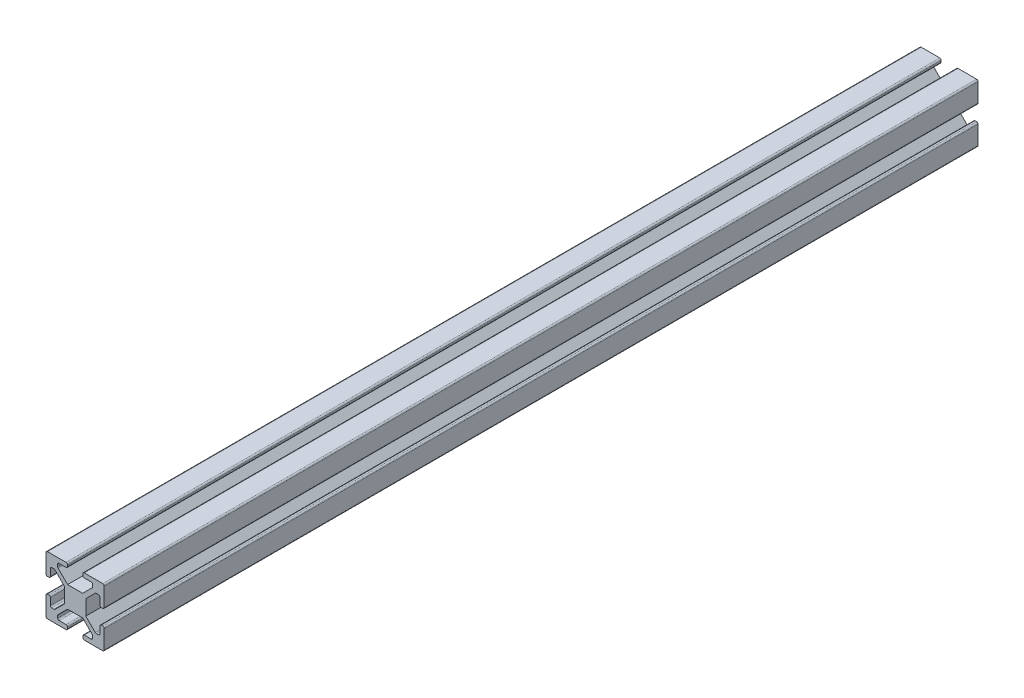
from build123d import *

# Parameters (mm, degrees)
BOSS_EXTRUDE1_DEPTH = 300
FILLET1_R           = 0.5


with BuildPart() as part:
    # Sketch1 → Boss-Extrude1 (new body)
    with BuildSketch(Plane.XY):
        Polygon((-10, 2.63), (-10, 10), (-2.63, 10), (-2.63, 8.5), (-5.995, 8.5), (-5.995, 7.055660172), (-2.594339828, 3.655), (2.594339828, 3.655), (5.995, 7.055660172), (5.995, 8.5), (2.63, 8.5), (2.63, 10), (10, 10), (10, 2.63), (8.5, 2.63), (8.5, 5.995), (7.055660172, 5.995), (3.655, 2.594339828), (3.655, -2.594339828), (7.055660172, -5.995), (8.5, -5.995), (8.5, -2.63), (10, -2.63), (10, -10), (2.63, -10), (2.63, -8.5), (5.995, -8.5), (5.995, -7.055660172), (2.594339828, -3.655), (-2.594339828, -3.655), (-5.995, -7.055660172), (-5.995, -8.5), (-2.63, -8.5), (-2.63, -10), (-10, -10), (-10, -2.63), (-8.5, -2.63), (-8.5, -5.995), (-7.055660172, -5.995), (-3.655, -2.594339828), (-3.655, 2.594339828), (-7.055660172, 5.995), (-8.5, 5.995), (-8.5, 2.63), align=None)
    extrude(amount=-BOSS_EXTRUDE1_DEPTH)

    # Fillet1
    fillet1_edges = [part.edges().sort_by_distance(p)[0] for p in [
        (10, 10, -150),
        (7.055660172, 5.995, -150),
        (8.5, 2.63, -150),
        (10, 2.63, -150),
        (8.5, 5.995, -150),
        (2.63, 10, -150),
        (2.63, 8.5, -150),
        (5.995, 8.5, -150),
        (5.995, 7.055660172, -150),
        (10, -10, -150),
        (10, -2.63, -150),
        (8.5, -2.63, -150),
        (8.5, -5.995, -150),
        (7.055660172, -5.995, -150),
        (5.995, -7.055660172, -150),
        (5.995, -8.5, -150),
        (2.63, -8.5, -150),
        (2.63, -10, -150),
        (-10, -10, -150),
        (-2.63, -10, -150),
        (-2.63, -8.5, -150),
        (-5.995, -8.5, -150),
        (-5.995, -7.055660172, -150),
        (-7.055660172, -5.995, -150),
        (-8.5, -5.995, -150),
        (-10, -2.63, -150),
        (-8.5, -2.63, -150),
        (-7.055660172, 5.995, -150),
        (-10, 10, -150),
        (-10, 2.63, -150),
        (-8.5, 2.63, -150),
        (-8.5, 5.995, -150),
        (-5.995, 8.5, -150),
        (-5.995, 7.055660172, -150),
        (-2.63, 8.5, -150),
        (-2.63, 10, -150),
    ]]
    fillet(fillet1_edges, radius=FILLET1_R)


solid = part.part
